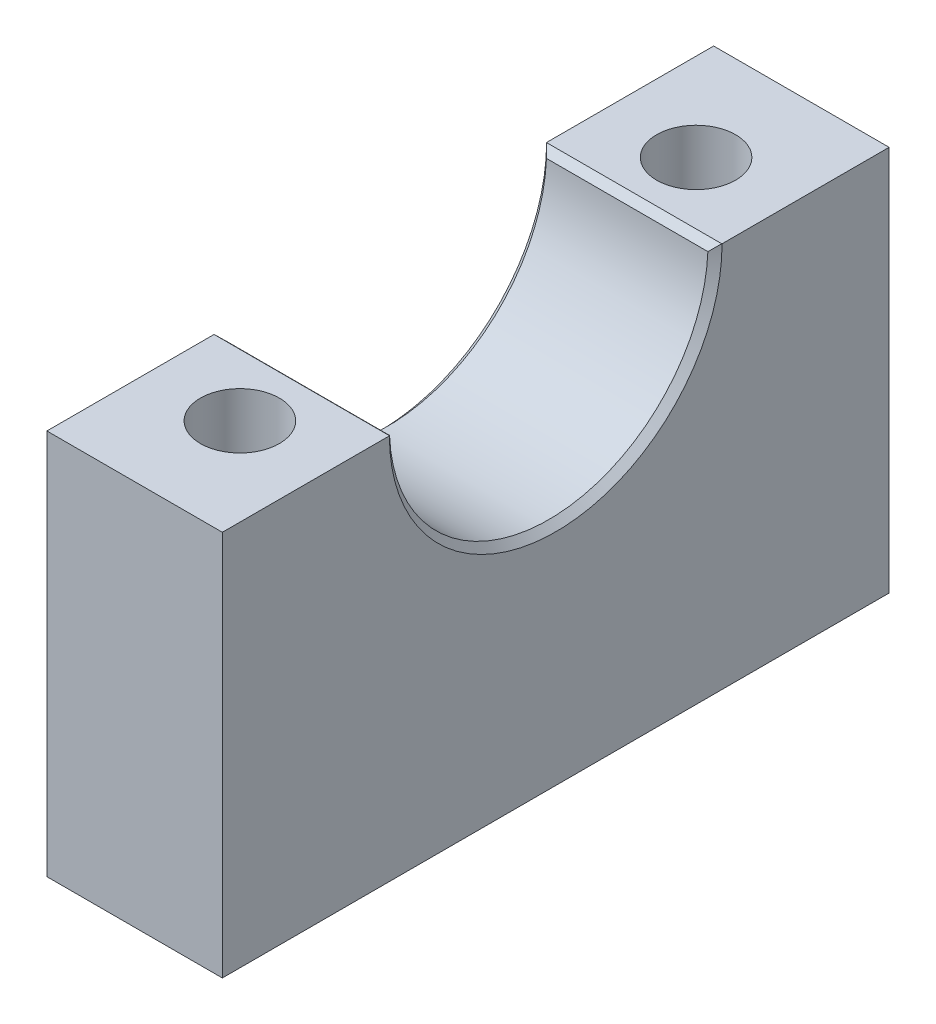
from build123d import *

# Parameters (mm, degrees)
BOSS_EXTRUDE1_DEPTH                           = 15.875
BOSS_EXTRUDE2_DEPTH                           = 15.875
CBORE_FOR_1_4_SOCKET_HEAD_CAP_SCREW1_AT_COUNT = 2
CBORE_FOR_1_4_SOCKET_HEAD_CAP_SCREW1_AT_PITCH = 41.275
MOVE_FACE1_BY                                 = 0.127
MOVE_FACE1_2_BY                               = 0.127
MOVE_START                                    = 28.575
MOVE_FACE2_OUTLINE_W                          = 15.875
MOVE_FACE2_OUTLINE_H                          = 60.325
MOVE_FACE2_OUTLINE_R                          = 5.55625
MOVE_FACE2_DEPTH                              = 6.35
MOVE_START_2                                  = 22.225
MOVE_FACE2_2_OUTLINE_R                        = 5.55625
MOVE_FACE2_2_OUTLINE_R_2                      = 3.57124
MOVE_FACE2_2_DEPTH                            = 6.35


with BuildPart() as part:
    # Sketch1 → Boss-Extrude1 (new body)
    with BuildSketch(Plane(origin=(0, 0, 0), x_dir=(0, 0, -1), z_dir=(1, 0, 0))):
        with BuildLine():
            Line((30.1625, 0), (14.2875, 0))
            ThreePointArc((14.2875, 0), (0, -14.2875), (-14.2875, 0))
            Line((-14.2875, 0), (-30.1625, 0))
            Line((-30.1625, 0), (-30.1625, -34.925))
            Line((-30.1625, -34.925), (30.1625, -34.925))
            Line((30.1625, -34.925), (30.1625, 0))
        make_face()
    extrude(amount=BOSS_EXTRUDE1_DEPTH)


with BuildPart() as body_2:
    # Sketch1<3> → Boss-Extrude2 (new body)
    with BuildSketch(Plane(origin=(0, 0, 0), x_dir=(0, 0, -1), z_dir=(1, 0, 0))):
        with BuildLine():
            ThreePointArc((-14.2875, 0), (0, 14.2875), (14.2875, 0))
            Line((14.2875, 0), (30.1625, 0))
            Line((30.1625, 0), (30.1625, 34.925))
            Line((30.1625, 34.925), (-30.1625, 34.925))
            Line((-30.1625, 34.925), (-30.1625, 0))
            Line((-30.1625, 0), (-14.2875, 0))
        make_face()
    extrude(amount=BOSS_EXTRUDE2_DEPTH)


with BuildPart() as cbore_for_1_4_socket_head_cap_screw1_tool:
    # Sketch4 → CBORE for 1/4 Socket Head Cap Screw1 (revolve)
    with BuildSketch(Plane(origin=(7.9375, 34.925, 20.6375), x_dir=(0, 0, 1), z_dir=(1, 0, 0))):
        Polygon((0, 0), (0, 69.85), (3.57124, 69.85), (3.57124, 6.35), (5.55625, 6.35), (5.55625, 0.635), (6.19125, 0), align=None)
    cbore_for_1_4_socket_head_cap_screw1 = revolve(axis=Axis((7.9375, 41.275, 20.6375), (0, -1, 0)))


with BuildPart() as part_1:
    add(part.part)

    # CBORE for 1/4 Socket Head Cap Screw1: cut by cbore_for_1_4_socket_head_cap_screw1_tool
    add(cbore_for_1_4_socket_head_cap_screw1_tool.part, mode=Mode.SUBTRACT)


with BuildPart() as body_2_1:
    add(body_2.part)

    # CBORE for 1/4 Socket Head Cap Screw1: cut by cbore_for_1_4_socket_head_cap_screw1_tool
    add(cbore_for_1_4_socket_head_cap_screw1_tool.part, mode=Mode.SUBTRACT)


with BuildPart() as cbore_for_1_4_socket_head_cap_screw1_at_tool:
    # CBORE for 1/4 Socket Head Cap Screw1 at: CBORE for 1/4 Socket Head Cap Screw1 ×2
    with Locations(*[(0, 0, -i * CBORE_FOR_1_4_SOCKET_HEAD_CAP_SCREW1_AT_PITCH) for i in range(1, CBORE_FOR_1_4_SOCKET_HEAD_CAP_SCREW1_AT_COUNT)]):
        add(cbore_for_1_4_socket_head_cap_screw1)


with BuildPart() as part_2:
    add(part_1.part)

    # CBORE for 1/4 Socket Head Cap Screw1 at: cut by cbore_for_1_4_socket_head_cap_screw1_at_tool
    add(cbore_for_1_4_socket_head_cap_screw1_at_tool.part, mode=Mode.SUBTRACT)

    # Move Face1 2: a curved face moved inward by 0.127
    add(Solid.thicken(part_2.faces().sort_by_distance((7.9375, -14.2875, 0))[0], -MOVE_FACE1_2_BY), mode=Mode.SUBTRACT)

    # Chamfer2
    # the kernel refuses this chamfer: 0.635 mm, written as the material it takes off along each edge
    with BuildSketch(Plane(origin=(0, 0, 0), x_dir=(0, 0.1132288377802066, -0.9935689358544497), z_dir=(0, 0.9935689358544497, 0.1132288377802066))) as chamfer2_piece_1:
        with BuildLine():
            Line((15.067460512, 0.017960512), (14.396539488, -0.652960512))
            Line((14.396539488, -0.652960512), (14.383839488, -0.652960512))
            ThreePointArc((14.383839488, -0.652960512), (14.4018, -0.326480256), (14.4018, 0))
            Line((14.4018, 0), (14.4145, 0.0127))
            ThreePointArc((14.4145, 0.0127), (14.740980256, 0.0127), (15.067460512, 0.030660512))
            Line((15.067460512, 0.030660512), (15.067460512, 0.017960512))
        make_face()
    revolve(axis=Axis((0, 0, 0), (-1, 0, 0)), revolution_arc=193.002955297, mode=Mode.SUBTRACT)
    with BuildSketch(Plane(origin=(-1.600435701, 0, -14.4145), x_dir=(0, 0, -1), z_dir=(1, 0, 0))) as chamfer2_piece_2:
        with BuildLine():
            Line((0.639932919, 0.017577515), (-0.031172593, -0.625784266))
            Line((-0.031172593, -0.625784266), (-0.043861283, -0.625248401))
            ThreePointArc((-0.043861283, -0.625248401), (-0.016099091, -0.31288099), (-0.0127, 0))
            Line((-0.0127, 0), (0, 0.0127))
            ThreePointArc((0, 0.0127), (0.319966459, 0.0127), (0.639932919, 0.030277515))
            Line((0.639932919, 0.030277515), (0.639932919, 0.017577515))
        make_face()
    extrude(amount=19.075871403, mode=Mode.SUBTRACT)
    with BuildSketch(Plane(origin=(-1.600435701, 0, 14.4145), x_dir=(0, -0.999777333387341, -0.021101745067597762), z_dir=(1, 0, 0))) as chamfer2_piece_3:
        with BuildLine():
            Line((0.626302721, 0.017960512), (-0.031077302, -0.639419511))
            Line((-0.031077302, -0.639419511), (-0.043774474, -0.639151519))
            ThreePointArc((-0.043774474, -0.639151519), (-0.019449023, -0.319627221), (-0.012697172, 0.000267992))
            Line((-0.012697172, 0.000267992), (0.000267992, 0.012697172))
            ThreePointArc((0.000267992, 0.012697172), (0.313151041, 0.009493172), (0.626034729, 0.030657684))
            Line((0.626034729, 0.030657684), (0.626302721, 0.017960512))
        make_face()
    extrude(amount=19.075871403, mode=Mode.SUBTRACT)
    with BuildSketch(Plane(origin=(15.875, 0, 0), x_dir=(0, 0.11322883778020662, -0.9935689358544497), z_dir=(0, 0.9935689358544497, 0.11322883778020662))) as chamfer2_piece_4:
        with BuildLine():
            Line((14.396539488, 0.652960512), (15.067460512, -0.017960512))
            Line((15.067460512, -0.017960512), (15.067460512, -0.030660512))
            ThreePointArc((15.067460512, -0.030660512), (14.740980256, -0.0127), (14.4145, -0.0127))
            Line((14.4145, -0.0127), (14.4018, 0))
            ThreePointArc((14.4018, 0), (14.4018, 0.326480256), (14.383839488, 0.652960512))
            Line((14.383839488, 0.652960512), (14.396539488, 0.652960512))
        make_face()
    revolve(axis=Axis((15.875, 0, 0), (-1, 0, 0)), revolution_arc=193.002955297, mode=Mode.SUBTRACT)


with BuildPart() as body_2_2:
    add(body_2_1.part)

    # CBORE for 1/4 Socket Head Cap Screw1 at: cut by cbore_for_1_4_socket_head_cap_screw1_at_tool
    add(cbore_for_1_4_socket_head_cap_screw1_at_tool.part, mode=Mode.SUBTRACT)

    # Move Face1: a curved face moved inward by 0.127
    add(Solid.thicken(body_2_2.faces().sort_by_distance((7.9375, 14.2875, 0))[0], -MOVE_FACE1_BY), mode=Mode.SUBTRACT)

    # Move Face2: read off the stored shape, not the designer's step
    # Move Face2 outline → Move Face2 (cut)
    with BuildSketch(Plane(origin=(0, 0, 0), x_dir=(1, 0, 0), z_dir=(0, 1, 0)).offset(MOVE_START)):
        with Locations((7.9375, 0)):
            Rectangle(MOVE_FACE2_OUTLINE_W, MOVE_FACE2_OUTLINE_H)
        with Locations((7.9375, -20.6375)):
            Circle(MOVE_FACE2_OUTLINE_R, mode=Mode.SUBTRACT)
        with Locations((7.9375, 20.6375)):
            Circle(MOVE_FACE2_OUTLINE_R, mode=Mode.SUBTRACT)
    extrude(amount=MOVE_FACE2_DEPTH, mode=Mode.SUBTRACT)

    # Move Face2 2 outline → Move Face2 2 (cut)
    # profile 1 of 2: a face of its own
    with BuildSketch(Plane(origin=(0, 0, 0), x_dir=(1, 0, 0), z_dir=(0, 1, 0)).offset(MOVE_START_2)):
        with Locations((7.9375, 20.6375)):
            Circle(MOVE_FACE2_2_OUTLINE_R)
        with Locations((7.9375, 20.6375)):
            Circle(MOVE_FACE2_2_OUTLINE_R_2, mode=Mode.SUBTRACT)
    # profile 2 of 2: a face of its own
    with BuildSketch(Plane(origin=(0, 0, 0), x_dir=(1, 0, 0), z_dir=(0, 1, 0)).offset(MOVE_START_2)):
        with Locations((7.9375, -20.6375)):
            Circle(MOVE_FACE2_2_OUTLINE_R)
        with Locations((7.9375, -20.6375)):
            Circle(MOVE_FACE2_2_OUTLINE_R_2, mode=Mode.SUBTRACT)
    extrude(amount=MOVE_FACE2_2_DEPTH, mode=Mode.SUBTRACT)

    # Move Face2 3: loft between two sections, ruled curve by curve
    move_face2_3_from = [
        Edge.make_three_point_arc((7.9375, 27.94, -15.08125), (13.49375, 27.94, -20.6375), (7.9375, 27.94, -26.19375)),
        Edge.make_three_point_arc((7.9375, 27.94, -26.19375), (2.38125, 27.94, -20.6375), (7.9375, 27.94, -15.08125)),
    ]
    move_face2_3_to = [
        Edge.make_three_point_arc((7.9375, 28.575, -14.44625), (14.12875, 28.575, -20.6375), (7.9375, 28.575, -26.82875)),
        Edge.make_three_point_arc((7.9375, 28.575, -26.82875), (1.74625, 28.575, -20.6375), (7.9375, 28.575, -14.44625)),
    ]
    move_face2_3 = Solid(Shell([*[Face.make_surface_from_curves(move_face2_3_from[k], move_face2_3_to[k]) for k in range(2)], Face(Wire(move_face2_3_from)), Face(Wire(move_face2_3_to))]))
    add(move_face2_3, mode=Mode.SUBTRACT)

    # Move Face2 4: loft between two sections, ruled curve by curve
    move_face2_4_from = [
        Edge.make_three_point_arc((7.9375, 27.94, 26.19375), (13.49375, 27.94, 20.6375), (7.9375, 27.94, 15.08125)),
        Edge.make_three_point_arc((7.9375, 27.94, 15.08125), (2.38125, 27.94, 20.6375), (7.9375, 27.94, 26.19375)),
    ]
    move_face2_4_to = [
        Edge.make_three_point_arc((7.9375, 28.575, 26.82875), (14.12875, 28.575, 20.6375), (7.9375, 28.575, 14.44625)),
        Edge.make_three_point_arc((7.9375, 28.575, 14.44625), (1.74625, 28.575, 20.6375), (7.9375, 28.575, 26.82875)),
    ]
    move_face2_4 = Solid(Shell([*[Face.make_surface_from_curves(move_face2_4_from[k], move_face2_4_to[k]) for k in range(2)], Face(Wire(move_face2_4_from)), Face(Wire(move_face2_4_to))]))
    add(move_face2_4, mode=Mode.SUBTRACT)

    # Chamfer1
    # the kernel refuses this chamfer: 0.635 mm, written as the material it takes off along each edge
    with BuildSketch(Plane(origin=(0, 0, 0), x_dir=(0, -0.11322883778020673, 0.9935689358544497), z_dir=(0, -0.9935689358544497, -0.11322883778020673))) as chamfer1_piece_1:
        with BuildLine():
            Line((15.067460512, 0.017960512), (14.396539488, -0.652960512))
            Line((14.396539488, -0.652960512), (14.383839488, -0.652960512))
            ThreePointArc((14.383839488, -0.652960512), (14.4018, -0.326480256), (14.4018, 0))
            Line((14.4018, 0), (14.4145, 0.0127))
            ThreePointArc((14.4145, 0.0127), (14.740980256, 0.0127), (15.067460512, 0.030660512))
            Line((15.067460512, 0.030660512), (15.067460512, 0.017960512))
        make_face()
    revolve(axis=Axis((0, 0, 0), (-1, 0, 0)), revolution_arc=193.002955297, mode=Mode.SUBTRACT)
    with BuildSketch(Plane(origin=(-1.600435701, 0, 14.4145), x_dir=(0, 0, 1), z_dir=(1, 0, 0))) as chamfer1_piece_2:
        with BuildLine():
            Line((0.639932919, 0.017577515), (-0.031172593, -0.625784266))
            Line((-0.031172593, -0.625784266), (-0.043861283, -0.625248401))
            ThreePointArc((-0.043861283, -0.625248401), (-0.016099091, -0.31288099), (-0.0127, 0))
            Line((-0.0127, 0), (0, 0.0127))
            ThreePointArc((0, 0.0127), (0.319966459, 0.0127), (0.639932919, 0.030277515))
            Line((0.639932919, 0.030277515), (0.639932919, 0.017577515))
        make_face()
    extrude(amount=19.075871403, mode=Mode.SUBTRACT)
    with BuildSketch(Plane(origin=(-1.600435701, 0, -14.4145), x_dir=(0, 0.999777333387341, 0.021101745067597762), z_dir=(1, 0, 0))) as chamfer1_piece_3:
        with BuildLine():
            Line((0.626302721, 0.017960512), (-0.031077302, -0.639419511))
            Line((-0.031077302, -0.639419511), (-0.043774474, -0.639151519))
            ThreePointArc((-0.043774474, -0.639151519), (-0.019449023, -0.319627221), (-0.012697172, 0.000267992))
            Line((-0.012697172, 0.000267992), (0.000267992, 0.012697172))
            ThreePointArc((0.000267992, 0.012697172), (0.313151041, 0.009493172), (0.626034729, 0.030657684))
            Line((0.626034729, 0.030657684), (0.626302721, 0.017960512))
        make_face()
    extrude(amount=19.075871403, mode=Mode.SUBTRACT)
    with BuildSketch(Plane(origin=(15.875, 0, 0), x_dir=(0, -0.11322883778020675, 0.9935689358544497), z_dir=(0, -0.9935689358544497, -0.11322883778020675))) as chamfer1_piece_4:
        with BuildLine():
            Line((14.396539488, 0.652960512), (15.067460512, -0.017960512))
            Line((15.067460512, -0.017960512), (15.067460512, -0.030660512))
            ThreePointArc((15.067460512, -0.030660512), (14.740980256, -0.0127), (14.4145, -0.0127))
            Line((14.4145, -0.0127), (14.4018, 0))
            ThreePointArc((14.4018, 0), (14.4018, 0.326480256), (14.383839488, 0.652960512))
            Line((14.383839488, 0.652960512), (14.396539488, 0.652960512))
        make_face()
    revolve(axis=Axis((15.875, 0, 0), (-1, 0, 0)), revolution_arc=193.002955297, mode=Mode.SUBTRACT)


solid = part_2.part
